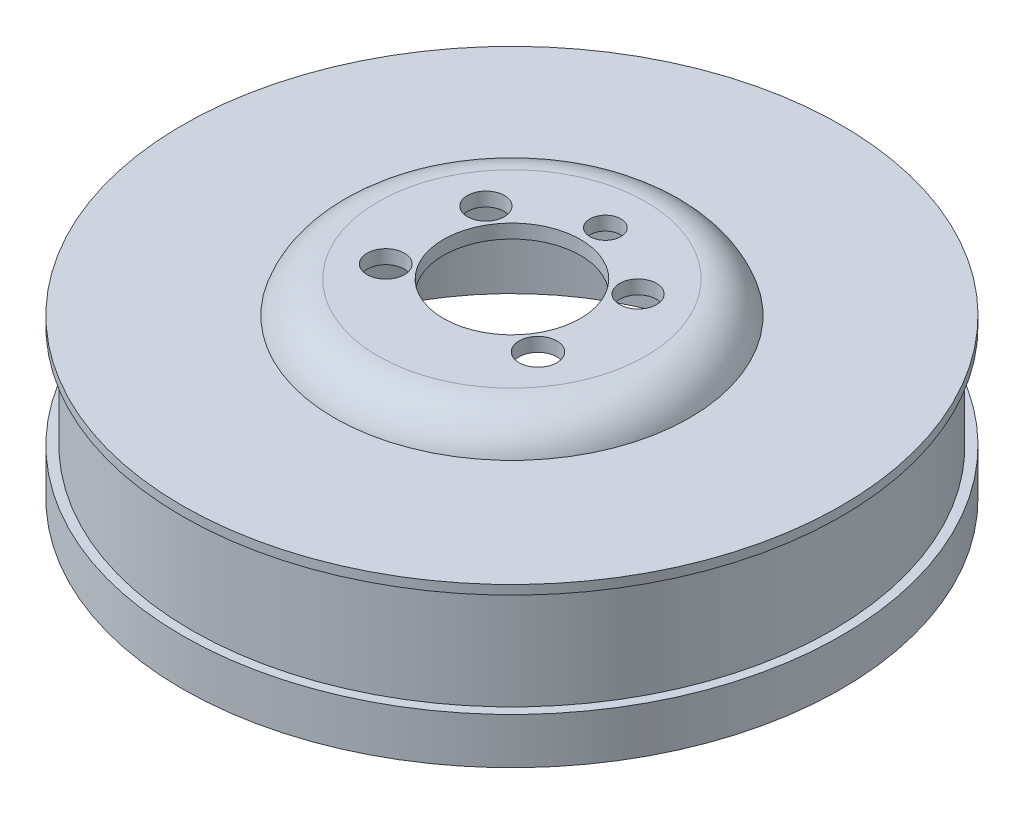
from build123d import *

# Parameters (mm, degrees)
REDONDEO2_R           = 10
CROQUIS3_R            = 14.85
CORTAR_EXTRUIR1_DEPTH = 10
CROQUIS4_R            = 3.35
CROQUIS4_R_2          = 4
CROQUIS4_R_3          = 4.1
CROQUIS4_R_4          = 4.05
CORTAR_EXTRUIR2_DEPTH = 10
REDONDEO3_R           = 10
REDONDEO4_R           = 1


with BuildPart() as part:
    # Croquis2 → Revolución1 (revolve)
    with BuildSketch(Plane.XY, mode=Mode.PRIVATE) as revoluci_n1_sk:
        Polygon((54.45, 0), (71.45, 0), (71.45, 10), (69.45, 10), (69.45, 32.4), (71.45, 32.4), (71.45, 34.4), (38.5, 34.4), (38.5, 41.25), (0, 41.25), (0, 38.25), (35.5, 38.25), (35.5, 31.4), (54.45, 31.4), align=None)
    revolve(revoluci_n1_sk.sketch.rotate(Axis((0, 41.25, 0), (0, -1, 0)), 90), axis=Axis((0, 41.25, 0), (0, -1, 0)))

    # Redondeo2
    # the kernel refuses this fillet: 10 mm, written as the material it takes off along each edge
    with BuildSketch(Plane(origin=(0, 41.25, 0), x_dir=(0, 0, 1), z_dir=(1, 0, 0))) as redondeo2_piece_1:
        with BuildLine():
            CenterArc((29.00908329, 10), REDONDEO2_R, 270, 71.639186206)
            Line((29.00908329, 0), (29.00908329, -0.2))
            Line((29.00908329, -0.2), (38.5, -0.2))
            Line((38.5, -0.2), (38.7, 0))
            ThreePointArc((38.7, 0), (38.7, 3.425), (38.689818334, 6.787))
            Line((38.689818334, 6.787), (38.5, 6.85))
        make_face()
    revolve(axis=Axis((0, 41.25, 0), (0, -1, 0)), mode=Mode.SUBTRACT)

    # Croquis3 → Cortar-Extruir1 (cut)
    with BuildSketch(Plane(origin=(0, 41.25, 0), x_dir=(1, 0, 0), z_dir=(0, 1, 0))):
        with Locations(Location((0, 0, 0), (0, 0, 270))):
            Circle(CROQUIS3_R)
    extrude(amount=-CORTAR_EXTRUIR1_DEPTH, mode=Mode.SUBTRACT)

    # Croquis4 → Cortar-Extruir2 (cut)
    with BuildSketch(Plane(origin=(0, 41.25, 0), x_dir=(1, 0, 0), z_dir=(0, 1, 0))):
        with Locations(Location((0.518366506, 19.743196199, 0), (0, 0, 270))):
            Circle(CROQUIS4_R)
        with Locations(Location((-16.5, 10.854146673, 0), (0, 0, 270))):
            Circle(CROQUIS4_R_2)
        with Locations(Location((16.5, 10.854146673, 0), (0, 0, 270))):
            Circle(CROQUIS4_R_2)
        with Locations(Location((16.5, -10.854146673, 0), (0, 0, 270))):
            Circle(CROQUIS4_R_3)
        with Locations(Location((-16.5, -10.854146673, 0), (0, 0, 270))):
            Circle(CROQUIS4_R_4)
    extrude(amount=-CORTAR_EXTRUIR2_DEPTH, mode=Mode.SUBTRACT)

    # Redondeo3
    # the kernel refuses this fillet: 10 mm, written as the material it takes off along each edge
    with BuildSketch(Plane(origin=(0, 31.4, 0), x_dir=(0, 0, 1), z_dir=(1, 0, 0))) as redondeo3_piece_1:
        with BuildLine():
            CenterArc((44.99091671, -10), REDONDEO3_R, 90, 71.639186206)
            Line((35.5, -6.85), (35.310181666, -6.787))
            ThreePointArc((35.310181666, -6.787), (35.3, -3.425), (35.3, 0))
            Line((35.3, 0), (35.5, 0.2))
            Line((35.5, 0.2), (44.99091671, 0.2))
            Line((44.99091671, 0.2), (44.99091671, 0))
        make_face()
    revolve(axis=Axis((0, 31.4, 0), (0, -1, 0)), mode=Mode.SUBTRACT)

    # Redondeo4
    redondeo4_edges = [part.edges().sort_by_distance(p)[0] for p in [
        (0, 31.4, -54.45),
    ]]
    fillet(redondeo4_edges, radius=REDONDEO4_R)


solid = part.part
